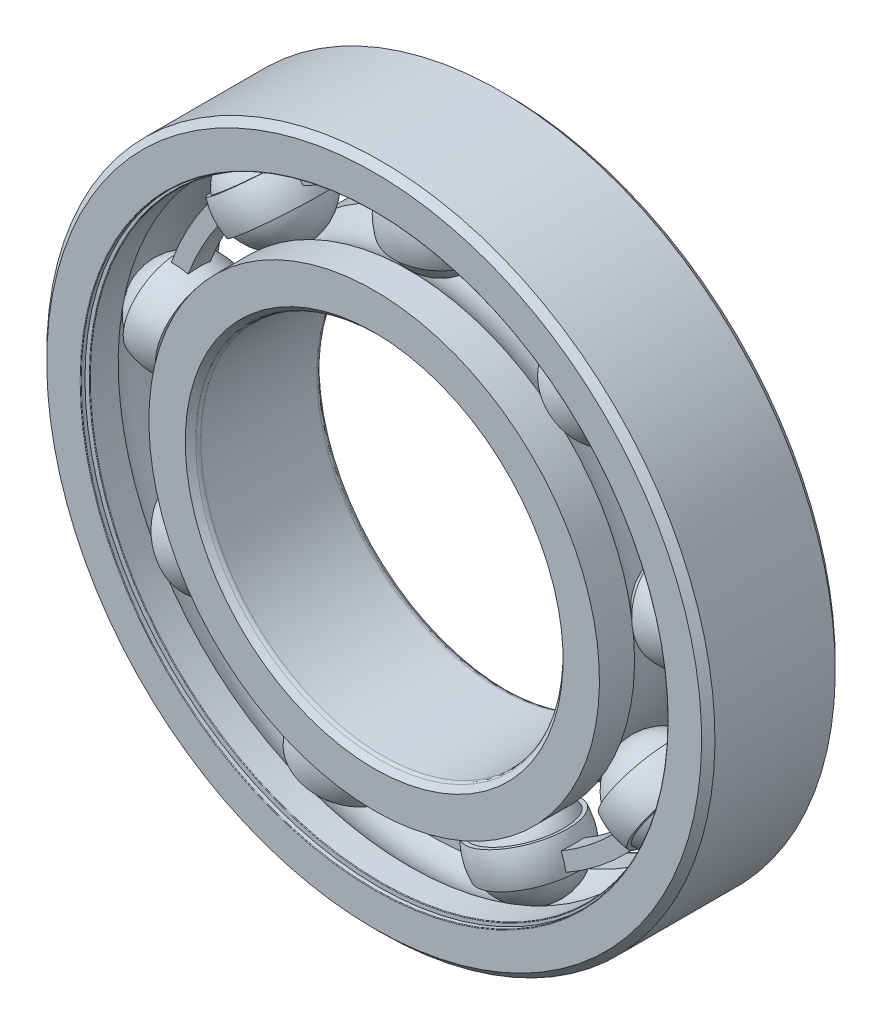
from build123d import *

# Parameters (mm, degrees)
BOSS_EXTRUDE1_DEPTH = 1.833333333
CIRPATTERN1_COUNT   = 9
CIRPATTERN2_COUNT   = 9
FILLET1_R           = 0.099
FILLET2_R           = 0.825


with BuildPart() as part:
    # Sketch3 → Revolve1 (revolve)
    with BuildSketch(Plane(origin=(0, 0, 0), x_dir=(0, 0, -1), z_dir=(1, 0, 0))):
        with BuildLine():
            Line((9.9, 55), (11, 53.9))
            Line((11, 53.9), (11, 47.915384615))
            Line((11, 47.915384615), (5.225, 47.915384615))
            ThreePointArc((5.225, 47.915384615), (0, 50.025092394), (-5.225, 47.915384615))
            Line((-5.225, 47.915384615), (-11, 47.915384615))
            Line((-11, 47.915384615), (-11, 53.9))
            Line((-11, 53.9), (-9.9, 55))
            Line((-9.9, 55), (9.9, 55))
        make_face()
    revolve(axis=Axis((0, 0, 11), (0, 0, -1)))

    # Sketch8 → Cut-Revolve1 (revolve, cut)
    with BuildSketch(Plane(origin=(0, 0, 0), x_dir=(0, 0, -1), z_dir=(1, 0, 0))):
        Polygon((-10.296, 47.915384615), (-9.9, 47.915384615), (-9.9, 50.276923077), (-10.296, 50.276923077), (-10.296, 48.311384615), (-11, 48.311384615), (-11, 47.915384615), align=None)
        Polygon((9.9, 47.915384615), (10.296, 47.915384615), (11, 47.915384615), (11, 48.311384615), (10.296, 48.311384615), (10.296, 50.276923077), (9.9, 50.276923077), align=None)
    revolve(axis=Axis((0, 0, 11), (0, 0, -1)), mode=Mode.SUBTRACT)

    # Fillet1
    fillet1_edges = [part.edges().sort_by_distance(p)[0] for p in [
        (0, -47.915384615, -9.9),
        (0, -48.311384615, -11),
        (0, -47.915384615, 9.9),
        (0, -48.311384615, 11),
    ]]
    fillet(fillet1_edges, radius=FILLET1_R)


with BuildPart() as body_2:
    # Sketch4 → Revolve2 (revolve)
    with BuildSketch(Plane(origin=(0, 0, 0), x_dir=(0, 0, -1), z_dir=(1, 0, 0))):
        with BuildLine():
            Line((-9.9, 30), (-11, 31.1))
            Line((-11, 31.1), (-11, 37.084615385))
            Line((-11, 37.084615385), (-5.225, 37.084615385))
            ThreePointArc((-5.225, 37.084615385), (0, 34.974907606), (5.225, 37.084615385))
            Line((5.225, 37.084615385), (11, 37.084615385))
            Line((11, 37.084615385), (11, 31.1))
            Line((11, 31.1), (9.9, 30))
            Line((9.9, 30), (-9.9, 30))
        make_face()
    revolve(axis=Axis((0, 0, 11), (0, 0, -1)))

    # Fillet2
    fillet2_edges = [body_2.edges().sort_by_distance(p)[0] for p in [
        (0, -30, -9.9),
        (0, -30, 9.9),
    ]]
    fillet(fillet2_edges, radius=FILLET2_R)


with BuildPart() as body_3:
    # Sketch5 → Revolve3 (revolve)
    with BuildSketch(Plane(origin=(0, 0, 0), x_dir=(0, 0, -1), z_dir=(1, 0, 0))):
        with BuildLine():
            Line((-7.525092394, 42.5), (7.525092394, 42.5))
            ThreePointArc((7.525092394, 42.5), (0, 50.025092394), (-7.525092394, 42.5))
        make_face()
    revolve(axis=Axis((0, 42.5, 7.525092394), (0, 0, -1)))


with BuildPart() as body_4:
    # Sketch6 → Revolve4 (revolve)
    with BuildSketch(Plane(origin=(0, 0, 0), x_dir=(0, 0, -1), z_dir=(1, 0, 0))):
        with BuildLine():
            Line((-7.021069569, 45.207692308), (-7.684224641, 45.207692308))
            ThreePointArc((-7.684224641, 45.207692308), (-8.015802177, 42.5), (-7.684224641, 39.792307692))
            Line((-7.684224641, 39.792307692), (-7.021069569, 39.792307692))
            ThreePointArc((-7.021069569, 39.792307692), (-7.525092394, 42.5), (-7.021069569, 45.207692308))
        make_face()
    revolve4 = revolve(axis=Axis((0, 55, 0), (0, -1, 0)))

    # Sketch7 → Boss-Extrude1 (add, symmetric)
    with BuildSketch(Plane.XY):
        with BuildLine():
            Line((27.318473412, 32.556888833), (29.058944478, 34.631101479))
            ThreePointArc((29.058944478, 34.631101479), (15.461941402, 42.481334864), (0, 45.207692308))
            Line((0, 45.207692308), (0, 42.5))
            ThreePointArc((0, 42.5), (14.535856091, 39.936936383), (27.318473412, 32.556888833))
        make_face()
    boss_extrude1 = extrude(amount=BOSS_EXTRUDE1_DEPTH, both=True)

    # CirPattern2: Revolve4, Boss-Extrude1 ×9 about axis
    cirpattern2_axis = Axis((0, 0, 11), (0, 0, -1))
    add([revolve4.rotate(cirpattern2_axis, i * 360 / CIRPATTERN2_COUNT) for i in range(1, CIRPATTERN2_COUNT)])
    add([boss_extrude1.rotate(cirpattern2_axis, i * 360 / CIRPATTERN2_COUNT) for i in range(1, CIRPATTERN2_COUNT)])


with BuildPart() as cirpattern1_1:
    # CirPattern1: pattern copy
    add(body_3.part.rotate(Axis((0, 0, 11), (0, 0, -1)), 1 * 360 / CIRPATTERN1_COUNT))


with BuildPart() as cirpattern1_2:
    # CirPattern1: pattern copy
    add(body_3.part.rotate(Axis((0, 0, 11), (0, 0, -1)), 2 * 360 / CIRPATTERN1_COUNT))


with BuildPart() as cirpattern1_3:
    # CirPattern1: pattern copy
    add(body_3.part.rotate(Axis((0, 0, 11), (0, 0, -1)), 3 * 360 / CIRPATTERN1_COUNT))


with BuildPart() as cirpattern1_4:
    # CirPattern1: pattern copy
    add(body_3.part.rotate(Axis((0, 0, 11), (0, 0, -1)), 4 * 360 / CIRPATTERN1_COUNT))


with BuildPart() as cirpattern1_5:
    # CirPattern1: pattern copy
    add(body_3.part.rotate(Axis((0, 0, 11), (0, 0, -1)), 5 * 360 / CIRPATTERN1_COUNT))


with BuildPart() as cirpattern1_6:
    # CirPattern1: pattern copy
    add(body_3.part.rotate(Axis((0, 0, 11), (0, 0, -1)), 6 * 360 / CIRPATTERN1_COUNT))


with BuildPart() as cirpattern1_7:
    # CirPattern1: pattern copy
    add(body_3.part.rotate(Axis((0, 0, 11), (0, 0, -1)), 7 * 360 / CIRPATTERN1_COUNT))


with BuildPart() as cirpattern1_8:
    # CirPattern1: pattern copy
    add(body_3.part.rotate(Axis((0, 0, 11), (0, 0, -1)), 8 * 360 / CIRPATTERN1_COUNT))


solid = Compound([part.part, body_2.part, body_3.part, body_4.part, cirpattern1_1.part, cirpattern1_2.part, cirpattern1_3.part, cirpattern1_4.part, cirpattern1_5.part, cirpattern1_6.part, cirpattern1_7.part, cirpattern1_8.part])
